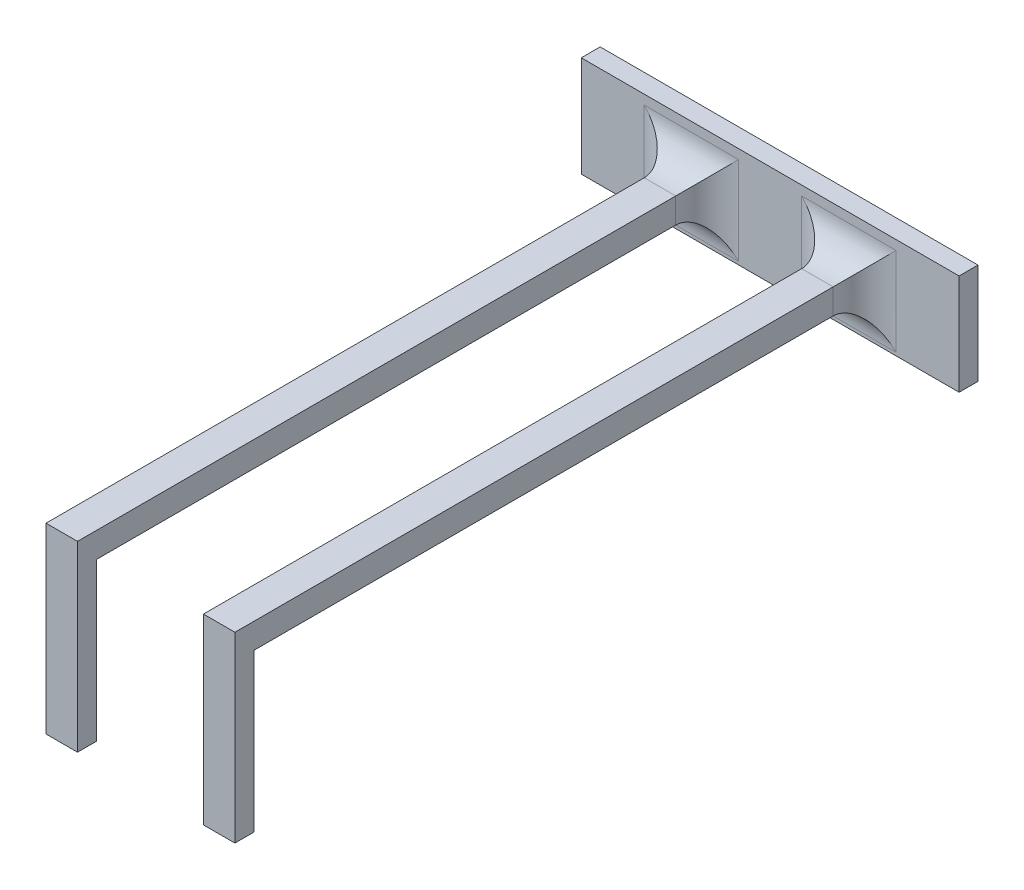
from build123d import *

# Parameters (mm, degrees)
SKETCH_1_W          = 60
SKETCH_1_H          = 16
EXTRUDE_1_DEPTH     = 3
SKETCH_2_W          = 60
SKETCH_2_H          = 4
EXTRUDE_2_DEPTH     = 100
SKETCH_3_W          = 5
SKETCH_3_H          = 3
EXTRUDE_3_DEPTH     = 25
SKETCH_4_W          = 15
SKETCH_4_H          = 100
SKETCH_4_W_2        = 20
CUT_EXTRUDE_1_DEPTH = 30
FILLET_1_R          = 5


with BuildPart() as part:
    # 草图1 → 凸台-拉伸1 (new body)
    with BuildSketch(Plane.XY):
        with Locations((7.850953206, 0.370883882)):
            Rectangle(SKETCH_1_W, SKETCH_1_H)
    extrude(amount=EXTRUDE_1_DEPTH)

    # 草图2 → 凸台-拉伸2 (add)
    with BuildSketch(Plane.XY.offset(3)):
        with Locations((7.850953206, -0.129116118)):
            Rectangle(SKETCH_2_W, SKETCH_2_H)
    extrude(amount=EXTRUDE_2_DEPTH)

    # 草图3 → 凸台-拉伸3 (add)
    with BuildSketch(Plane.XZ.offset(2.129116118)):
        with Locations((-4.649046794, 101.5)):
            Rectangle(SKETCH_3_W, SKETCH_3_H)
        with Locations((20.350953206, 101.5)):
            Rectangle(SKETCH_3_W, SKETCH_3_H)
    extrude(amount=EXTRUDE_3_DEPTH)

    # 草图4 → 切除-拉伸1 (cut)
    with BuildSketch(Plane.XZ.offset(2.129116118)):
        with Locations((-14.649046794, 53)):
            Rectangle(SKETCH_4_W, SKETCH_4_H)
        with Locations((7.850953206, 53)):
            Rectangle(SKETCH_4_W_2, SKETCH_4_H)
        with Locations((30.350953206, 53)):
            Rectangle(SKETCH_4_W, SKETCH_4_H)
    extrude(amount=-CUT_EXTRUDE_1_DEPTH, mode=Mode.SUBTRACT)

    # 圆角1
    fillet_1_edges = [part.edges().sort_by_distance(p)[0] for p in [
        (20.350953206, 1.870883882, 3),
        (22.850953206, -0.129116118, 3),
        (20.350953206, -2.129116118, 3),
        (17.850953206, -0.129116118, 3),
        (-4.649046794, 1.870883882, 3),
        (-2.149046794, -0.129116118, 3),
        (-4.649046794, -2.129116118, 3),
        (-7.149046794, -0.129116118, 3),
    ]]
    fillet(fillet_1_edges, radius=FILLET_1_R)


solid = part.part
